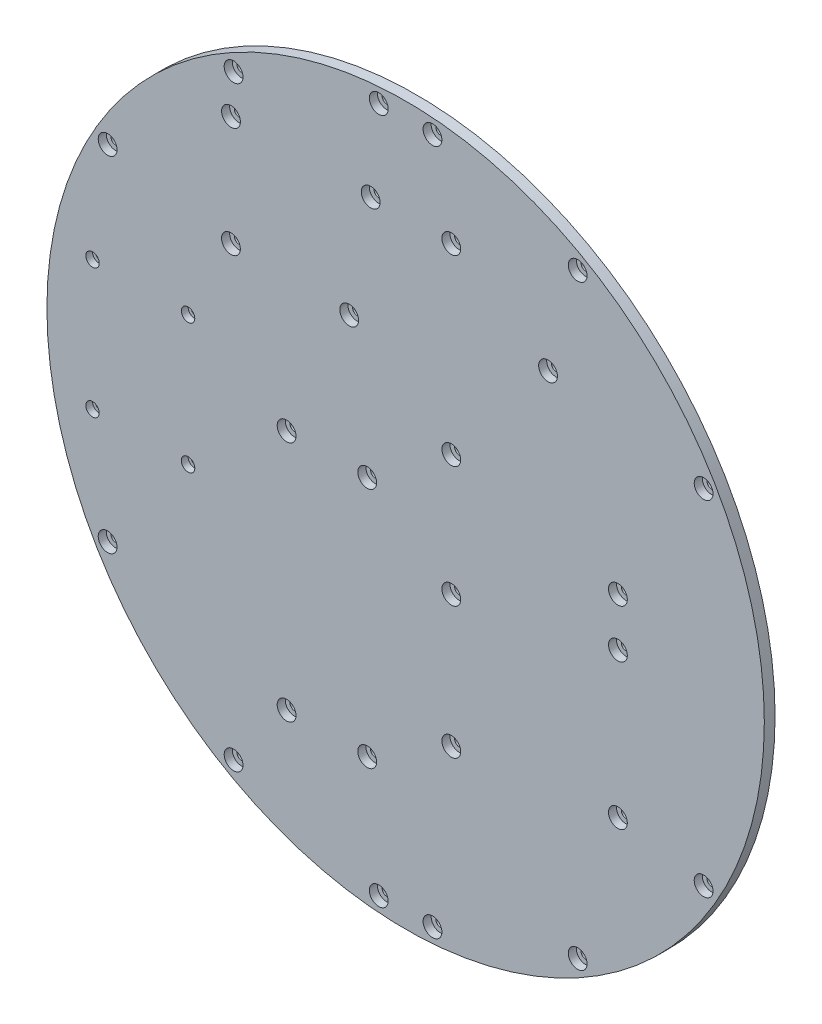
from build123d import *

# Parameters (mm, degrees)
ESQUISSE1_R              = 133.5
ESQUISSE1_R_2            = 1.75
BOSS_EXTRU_1_DEPTH       = 4
ESQUISSE2_R              = 3.5
ENL_V_MAT_EXTRU_1_DEPTH  = 3
ENL_V_MAT_EXTRU_2_REACH  = 190.84
ESQUISSE3_R              = 1.25
ESQUISSE4_R              = 2.5
ENL_V_MAT_EXTRU_3_DEPTH  = 2.5
ENL_V_MAT_EXTRU_4_REACH  = 190.84
ESQUISSE5_R              = 1.75
ESQUISSE6_R              = 3.5
ENL_V_MAT_EXTRU_5_DEPTH  = 3
ENL_V_MAT_EXTRU_6_REACH  = 190.84
ESQUISSE7_R              = 1.75
ESQUISSE8_R              = 3.5
ENL_V_MAT_EXTRU_7_DEPTH  = 3
ENL_V_MAT_EXTRU_8_REACH  = 190.84
ESQUISSE9_R              = 1.75
ESQUISSE10_R             = 3.5
ENL_V_MAT_EXTRU_9_DEPTH  = 3
ENL_V_MAT_EXTRU_10_REACH = 190.84
ESQUISSE11_R             = 1.75
ESQUISSE12_R             = 3.5
ENL_V_MAT_EXTRU_11_DEPTH = 3


with BuildPart() as part:
    # Esquisse1 → Boss.-Extru.1 (new body)
    with BuildSketch(Plane.XY):
        Circle(ESQUISSE1_R)
        with Locations((10, -127.668960989)):
            Circle(ESQUISSE1_R_2, mode=Mode.SUBTRACT)
        with Locations((-10, -127.668960989)):
            Circle(ESQUISSE1_R_2, mode=Mode.SUBTRACT)
        with Locations((10, 127.668960989)):
            Circle(ESQUISSE1_R_2, mode=Mode.SUBTRACT)
        with Locations((-10, 127.668960989)):
            Circle(ESQUISSE1_R_2, mode=Mode.SUBTRACT)
        with Locations((64.03, 110.903213209)):
            Circle(ESQUISSE1_R_2, mode=Mode.SUBTRACT)
        with Locations((110.903213209, 64.03)):
            Circle(ESQUISSE1_R_2, mode=Mode.SUBTRACT)
        with Locations((110.903213209, -64.03)):
            Circle(ESQUISSE1_R_2, mode=Mode.SUBTRACT)
        with Locations((64.03, -110.903213209)):
            Circle(ESQUISSE1_R_2, mode=Mode.SUBTRACT)
        with Locations((-64.03, -110.903213209)):
            Circle(ESQUISSE1_R_2, mode=Mode.SUBTRACT)
        with Locations((-110.903213209, -64.03)):
            Circle(ESQUISSE1_R_2, mode=Mode.SUBTRACT)
        with Locations((-110.903213209, 64.03)):
            Circle(ESQUISSE1_R_2, mode=Mode.SUBTRACT)
        with Locations((-64.03, 110.903213209)):
            Circle(ESQUISSE1_R_2, mode=Mode.SUBTRACT)
    extrude(amount=BOSS_EXTRU_1_DEPTH)

    # Esquisse2 → Enlèv. mat.-Extru.1 (cut)
    with BuildSketch(Plane.XY.offset(4)):
        with Locations((64.03, -110.903213209)):
            Circle(ESQUISSE2_R)
        with Locations((110.903213209, -64.03)):
            Circle(ESQUISSE2_R)
        with Locations((110.903213209, 64.03)):
            Circle(ESQUISSE2_R)
        with Locations((64.03, 110.903213209)):
            Circle(ESQUISSE2_R)
        with Locations((10, 127.668960989)):
            Circle(ESQUISSE2_R)
        with Locations((-10, 127.668960989)):
            Circle(ESQUISSE2_R)
        with Locations((-64.03, 110.903213209)):
            Circle(ESQUISSE2_R)
        with Locations((-110.903213209, 64.03)):
            Circle(ESQUISSE2_R)
        with Locations((-110.903213209, -64.03)):
            Circle(ESQUISSE2_R)
        with Locations((-64.03, -110.903213209)):
            Circle(ESQUISSE2_R)
        with Locations((-10, -127.668960989)):
            Circle(ESQUISSE2_R)
        with Locations((10, -127.668960989)):
            Circle(ESQUISSE2_R)
    extrude(amount=-ENL_V_MAT_EXTRU_1_DEPTH, mode=Mode.SUBTRACT)

    # Esquisse3 → Enlèv. mat.-Extru.2 (cut, up to next)
    with BuildSketch(Plane.XY.offset(4), mode=Mode.PRIVATE) as enl_v_mat_extru_2_sk1:
        with Locations((-116.52786405, -24.13)):
            Circle(ESQUISSE3_R)
    enl_v_mat_extru_2_tool1 = extrude(enl_v_mat_extru_2_sk1.sketch, amount=-ENL_V_MAT_EXTRU_2_REACH, mode=Mode.PRIVATE) & part.part
    # Esquisse3 → Enlèv. mat.-Extru.2 (cut, up to next)
    with BuildSketch(Plane.XY.offset(4), mode=Mode.PRIVATE) as enl_v_mat_extru_2_sk2:
        with Locations((-116.52786405, 24.13)):
            Circle(ESQUISSE3_R)
    enl_v_mat_extru_2_tool2 = extrude(enl_v_mat_extru_2_sk2.sketch, amount=-ENL_V_MAT_EXTRU_2_REACH, mode=Mode.PRIVATE) & part.part
    # Esquisse3 → Enlèv. mat.-Extru.2 (cut, up to next)
    with BuildSketch(Plane.XY.offset(4), mode=Mode.PRIVATE) as enl_v_mat_extru_2_sk3:
        with Locations((-80.96786405, 24.13)):
            Circle(ESQUISSE3_R)
    enl_v_mat_extru_2_tool3 = extrude(enl_v_mat_extru_2_sk3.sketch, amount=-ENL_V_MAT_EXTRU_2_REACH, mode=Mode.PRIVATE) & part.part
    # Esquisse3 → Enlèv. mat.-Extru.2 (cut, up to next)
    with BuildSketch(Plane.XY.offset(4), mode=Mode.PRIVATE) as enl_v_mat_extru_2_sk4:
        with Locations((-80.96786405, -24.13)):
            Circle(ESQUISSE3_R)
    enl_v_mat_extru_2_tool4 = extrude(enl_v_mat_extru_2_sk4.sketch, amount=-ENL_V_MAT_EXTRU_2_REACH, mode=Mode.PRIVATE) & part.part
    add(enl_v_mat_extru_2_tool1.solids().sort_by_distance((-116.527864, -24.13, 4))[0], mode=Mode.SUBTRACT)
    add(enl_v_mat_extru_2_tool2.solids().sort_by_distance((-116.527864, 24.13, 4))[0], mode=Mode.SUBTRACT)
    add(enl_v_mat_extru_2_tool3.solids().sort_by_distance((-80.967864, 24.13, 4))[0], mode=Mode.SUBTRACT)
    add(enl_v_mat_extru_2_tool4.solids().sort_by_distance((-80.967864, -24.13, 4))[0], mode=Mode.SUBTRACT)

    # Esquisse4 → Enlèv. mat.-Extru.3 (cut)
    with BuildSketch(Plane.XY.offset(4)):
        with Locations((-116.52786405, -24.13)):
            Circle(ESQUISSE4_R)
        with Locations((-116.52786405, 24.13)):
            Circle(ESQUISSE4_R)
        with Locations((-80.96786405, 24.13)):
            Circle(ESQUISSE4_R)
        with Locations((-80.96786405, -24.13)):
            Circle(ESQUISSE4_R)
    extrude(amount=-ENL_V_MAT_EXTRU_3_DEPTH, mode=Mode.SUBTRACT)

    # Esquisse5 → Enlèv. mat.-Extru.4 (cut, up to next)
    with BuildSketch(Plane.XY.offset(4), mode=Mode.PRIVATE) as enl_v_mat_extru_4_sk1:
        with Locations((-44.3, -85)):
            Circle(ESQUISSE5_R)
    enl_v_mat_extru_4_tool1 = extrude(enl_v_mat_extru_4_sk1.sketch, amount=-ENL_V_MAT_EXTRU_4_REACH, mode=Mode.PRIVATE) & part.part
    # Esquisse5 → Enlèv. mat.-Extru.4 (cut, up to next)
    with BuildSketch(Plane.XY.offset(4), mode=Mode.PRIVATE) as enl_v_mat_extru_4_sk2:
        with Locations((-44.3, 5)):
            Circle(ESQUISSE5_R)
    enl_v_mat_extru_4_tool2 = extrude(enl_v_mat_extru_4_sk2.sketch, amount=-ENL_V_MAT_EXTRU_4_REACH, mode=Mode.PRIVATE) & part.part
    # Esquisse5 → Enlèv. mat.-Extru.4 (cut, up to next)
    with BuildSketch(Plane.XY.offset(4), mode=Mode.PRIVATE) as enl_v_mat_extru_4_sk3:
        with Locations((-14.3, 5)):
            Circle(ESQUISSE5_R)
    enl_v_mat_extru_4_tool3 = extrude(enl_v_mat_extru_4_sk3.sketch, amount=-ENL_V_MAT_EXTRU_4_REACH, mode=Mode.PRIVATE) & part.part
    # Esquisse5 → Enlèv. mat.-Extru.4 (cut, up to next)
    with BuildSketch(Plane.XY.offset(4), mode=Mode.PRIVATE) as enl_v_mat_extru_4_sk4:
        with Locations((-14.3, -85)):
            Circle(ESQUISSE5_R)
    enl_v_mat_extru_4_tool4 = extrude(enl_v_mat_extru_4_sk4.sketch, amount=-ENL_V_MAT_EXTRU_4_REACH, mode=Mode.PRIVATE) & part.part
    add(enl_v_mat_extru_4_tool1.solids().sort_by_distance((-44.3, -85, 4))[0], mode=Mode.SUBTRACT)
    add(enl_v_mat_extru_4_tool2.solids().sort_by_distance((-44.3, 5, 4))[0], mode=Mode.SUBTRACT)
    add(enl_v_mat_extru_4_tool3.solids().sort_by_distance((-14.3, 5, 4))[0], mode=Mode.SUBTRACT)
    add(enl_v_mat_extru_4_tool4.solids().sort_by_distance((-14.3, -85, 4))[0], mode=Mode.SUBTRACT)

    # Esquisse6 → Enlèv. mat.-Extru.5 (cut)
    with BuildSketch(Plane.XY.offset(4)):
        with Locations((-44.3, -85)):
            Circle(ESQUISSE6_R)
        with Locations((-14.3, -85)):
            Circle(ESQUISSE6_R)
        with Locations((-44.3, 5)):
            Circle(ESQUISSE6_R)
        with Locations((-14.3, 5)):
            Circle(ESQUISSE6_R)
    extrude(amount=-ENL_V_MAT_EXTRU_5_DEPTH, mode=Mode.SUBTRACT)

    # Esquisse7 → Enlèv. mat.-Extru.6 (cut, up to next)
    with BuildSketch(Plane.XY.offset(4), mode=Mode.PRIVATE) as enl_v_mat_extru_6_sk1:
        with Locations((-65, 55)):
            Circle(ESQUISSE7_R)
    enl_v_mat_extru_6_tool1 = extrude(enl_v_mat_extru_6_sk1.sketch, amount=-ENL_V_MAT_EXTRU_6_REACH, mode=Mode.PRIVATE) & part.part
    # Esquisse7 → Enlèv. mat.-Extru.6 (cut, up to next)
    with BuildSketch(Plane.XY.offset(4), mode=Mode.PRIVATE) as enl_v_mat_extru_6_sk2:
        with Locations((-65, 96)):
            Circle(ESQUISSE7_R)
    enl_v_mat_extru_6_tool2 = extrude(enl_v_mat_extru_6_sk2.sketch, amount=-ENL_V_MAT_EXTRU_6_REACH, mode=Mode.PRIVATE) & part.part
    # Esquisse7 → Enlèv. mat.-Extru.6 (cut, up to next)
    with BuildSketch(Plane.XY.offset(4), mode=Mode.PRIVATE) as enl_v_mat_extru_6_sk3:
        with Locations((-21, 54)):
            Circle(ESQUISSE7_R)
    enl_v_mat_extru_6_tool3 = extrude(enl_v_mat_extru_6_sk3.sketch, amount=-ENL_V_MAT_EXTRU_6_REACH, mode=Mode.PRIVATE) & part.part
    # Esquisse7 → Enlèv. mat.-Extru.6 (cut, up to next)
    with BuildSketch(Plane.XY.offset(4), mode=Mode.PRIVATE) as enl_v_mat_extru_6_sk4:
        with Locations((-13, 96)):
            Circle(ESQUISSE7_R)
    enl_v_mat_extru_6_tool4 = extrude(enl_v_mat_extru_6_sk4.sketch, amount=-ENL_V_MAT_EXTRU_6_REACH, mode=Mode.PRIVATE) & part.part
    add(enl_v_mat_extru_6_tool1.solids().sort_by_distance((-65, 55, 4))[0], mode=Mode.SUBTRACT)
    add(enl_v_mat_extru_6_tool2.solids().sort_by_distance((-65, 96, 4))[0], mode=Mode.SUBTRACT)
    add(enl_v_mat_extru_6_tool3.solids().sort_by_distance((-21, 54, 4))[0], mode=Mode.SUBTRACT)
    add(enl_v_mat_extru_6_tool4.solids().sort_by_distance((-13, 96, 4))[0], mode=Mode.SUBTRACT)

    # Esquisse8 → Enlèv. mat.-Extru.7 (cut)
    with BuildSketch(Plane.XY.offset(4)):
        with Locations((-65, 55)):
            Circle(ESQUISSE8_R)
        with Locations((-65, 96)):
            Circle(ESQUISSE8_R)
        with Locations((-21, 54)):
            Circle(ESQUISSE8_R)
        with Locations((-13, 96)):
            Circle(ESQUISSE8_R)
    extrude(amount=-ENL_V_MAT_EXTRU_7_DEPTH, mode=Mode.SUBTRACT)

    # Esquisse9 → Enlèv. mat.-Extru.8 (cut, up to next)
    with BuildSketch(Plane(origin=(0, 0, 0), x_dir=(-1, 0, 0), z_dir=(0, 0, -1)), mode=Mode.PRIVATE) as enl_v_mat_extru_8_sk1:
        with Locations((-17, 96)):
            Circle(ESQUISSE9_R)
    enl_v_mat_extru_8_tool1 = extrude(enl_v_mat_extru_8_sk1.sketch, amount=-ENL_V_MAT_EXTRU_8_REACH, mode=Mode.PRIVATE) & part.part
    # Esquisse9 → Enlèv. mat.-Extru.8 (cut, up to next)
    with BuildSketch(Plane(origin=(0, 0, 0), x_dir=(-1, 0, 0), z_dir=(0, 0, -1)), mode=Mode.PRIVATE) as enl_v_mat_extru_8_sk2:
        with Locations((-17, 28)):
            Circle(ESQUISSE9_R)
    enl_v_mat_extru_8_tool2 = extrude(enl_v_mat_extru_8_sk2.sketch, amount=-ENL_V_MAT_EXTRU_8_REACH, mode=Mode.PRIVATE) & part.part
    # Esquisse9 → Enlèv. mat.-Extru.8 (cut, up to next)
    with BuildSketch(Plane(origin=(0, 0, 0), x_dir=(-1, 0, 0), z_dir=(0, 0, -1)), mode=Mode.PRIVATE) as enl_v_mat_extru_8_sk3:
        with Locations((-53, 73)):
            Circle(ESQUISSE9_R)
    enl_v_mat_extru_8_tool3 = extrude(enl_v_mat_extru_8_sk3.sketch, amount=-ENL_V_MAT_EXTRU_8_REACH, mode=Mode.PRIVATE) & part.part
    # Esquisse9 → Enlèv. mat.-Extru.8 (cut, up to next)
    with BuildSketch(Plane(origin=(0, 0, 0), x_dir=(-1, 0, 0), z_dir=(0, 0, -1)), mode=Mode.PRIVATE) as enl_v_mat_extru_8_sk4:
        with Locations((-79, 14)):
            Circle(ESQUISSE9_R)
    enl_v_mat_extru_8_tool4 = extrude(enl_v_mat_extru_8_sk4.sketch, amount=-ENL_V_MAT_EXTRU_8_REACH, mode=Mode.PRIVATE) & part.part
    add(enl_v_mat_extru_8_tool1.solids().sort_by_distance((17, 96, 0))[0], mode=Mode.SUBTRACT)
    add(enl_v_mat_extru_8_tool2.solids().sort_by_distance((17, 28, 0))[0], mode=Mode.SUBTRACT)
    add(enl_v_mat_extru_8_tool3.solids().sort_by_distance((53, 73, 0))[0], mode=Mode.SUBTRACT)
    add(enl_v_mat_extru_8_tool4.solids().sort_by_distance((79, 14, 0))[0], mode=Mode.SUBTRACT)

    # Esquisse10 → Enlèv. mat.-Extru.9 (cut)
    with BuildSketch(Plane.XY.offset(4)):
        with Locations((17, 28)):
            Circle(ESQUISSE10_R)
        with Locations((17, 96)):
            Circle(ESQUISSE10_R)
        with Locations((53, 73)):
            Circle(ESQUISSE10_R)
        with Locations((79, 14)):
            Circle(ESQUISSE10_R)
    extrude(amount=-ENL_V_MAT_EXTRU_9_DEPTH, mode=Mode.SUBTRACT)

    # Esquisse11 → Enlèv. mat.-Extru.10 (cut, up to next)
    with BuildSketch(Plane(origin=(0, 0, 0), x_dir=(-1, 0, 0), z_dir=(0, 0, -1)), mode=Mode.PRIVATE) as enl_v_mat_extru_10_sk1:
        with Locations((-17, -17)):
            Circle(ESQUISSE11_R)
    enl_v_mat_extru_10_tool1 = extrude(enl_v_mat_extru_10_sk1.sketch, amount=-ENL_V_MAT_EXTRU_10_REACH, mode=Mode.PRIVATE) & part.part
    # Esquisse11 → Enlèv. mat.-Extru.10 (cut, up to next)
    with BuildSketch(Plane(origin=(0, 0, 0), x_dir=(-1, 0, 0), z_dir=(0, 0, -1)), mode=Mode.PRIVATE) as enl_v_mat_extru_10_sk2:
        with Locations((-17, -66)):
            Circle(ESQUISSE11_R)
    enl_v_mat_extru_10_tool2 = extrude(enl_v_mat_extru_10_sk2.sketch, amount=-ENL_V_MAT_EXTRU_10_REACH, mode=Mode.PRIVATE) & part.part
    # Esquisse11 → Enlèv. mat.-Extru.10 (cut, up to next)
    with BuildSketch(Plane(origin=(0, 0, 0), x_dir=(-1, 0, 0), z_dir=(0, 0, -1)), mode=Mode.PRIVATE) as enl_v_mat_extru_10_sk3:
        with Locations((-79, -4)):
            Circle(ESQUISSE11_R)
    enl_v_mat_extru_10_tool3 = extrude(enl_v_mat_extru_10_sk3.sketch, amount=-ENL_V_MAT_EXTRU_10_REACH, mode=Mode.PRIVATE) & part.part
    # Esquisse11 → Enlèv. mat.-Extru.10 (cut, up to next)
    with BuildSketch(Plane(origin=(0, 0, 0), x_dir=(-1, 0, 0), z_dir=(0, 0, -1)), mode=Mode.PRIVATE) as enl_v_mat_extru_10_sk4:
        with Locations((-79, -58)):
            Circle(ESQUISSE11_R)
    enl_v_mat_extru_10_tool4 = extrude(enl_v_mat_extru_10_sk4.sketch, amount=-ENL_V_MAT_EXTRU_10_REACH, mode=Mode.PRIVATE) & part.part
    add(enl_v_mat_extru_10_tool1.solids().sort_by_distance((17, -17, 0))[0], mode=Mode.SUBTRACT)
    add(enl_v_mat_extru_10_tool2.solids().sort_by_distance((17, -66, 0))[0], mode=Mode.SUBTRACT)
    add(enl_v_mat_extru_10_tool3.solids().sort_by_distance((79, -4, 0))[0], mode=Mode.SUBTRACT)
    add(enl_v_mat_extru_10_tool4.solids().sort_by_distance((79, -58, 0))[0], mode=Mode.SUBTRACT)

    # Esquisse12 → Enlèv. mat.-Extru.11 (cut)
    with BuildSketch(Plane.XY.offset(4)):
        with Locations((17, -66)):
            Circle(ESQUISSE12_R)
        with Locations((17, -17)):
            Circle(ESQUISSE12_R)
        with Locations((79, -4)):
            Circle(ESQUISSE12_R)
        with Locations((79, -58)):
            Circle(ESQUISSE12_R)
    extrude(amount=-ENL_V_MAT_EXTRU_11_DEPTH, mode=Mode.SUBTRACT)


solid = part.part
